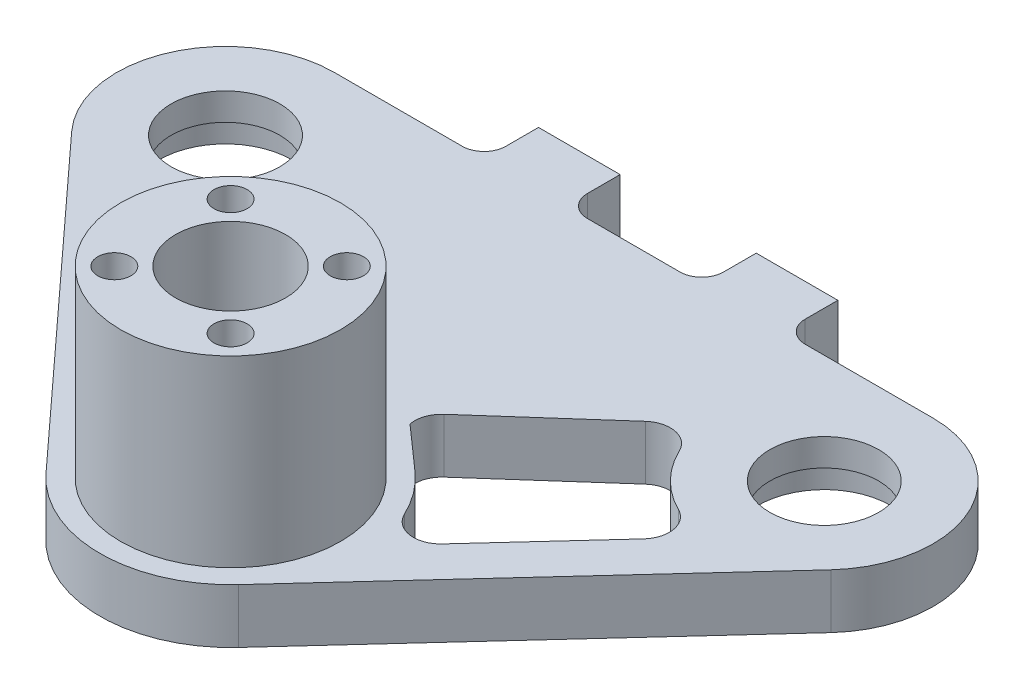
from build123d import *

# Parameters (mm, degrees)
SKETCH1_R              = 10.1
SKETCH1_R_2            = 10
MAIN_BODY_DEPTH        = 10
SKETCH2_R              = 12.2
BEARING_RECESS_DEPTH   = 5
STANDOFF_START         = 1.5
SKETCH3_R              = 21.5
SKETCH3_R_2            = 10.1
STANDOFF_SECTION_DEPTH = 1.5
SKETCH9_R              = 20.2
SKETCH9_R_2            = 10.1
BOSS_EXTRUDE1_DEPTH    = 33.7
EXTRA_GEOMETRY_DEPTH   = 10
SKETCH8_R              = 2
CUT_EXTRUDE1_DEPTH     = 6
SKETCH4_R              = 3.05
M6_BOLT_HOLES_DEPTH    = 122.389206984


with BuildPart() as part:
    # Sketch1 → Main Body (new body)
    with BuildSketch(Plane(origin=(0, 0, 0), x_dir=(1, 0, 0), z_dir=(0, 1, 0))):
        with BuildLine():
            Line((-69.741518057, 40.551033083), (-17.689821668, -16.219439242))
            ThreePointArc((-17.689821668, -16.219439242), (17.115072934, -16.824811395), (15.914514265, 17.96463848))
            Line((15.914514265, 17.96463848), (-41.737904779, 69.037764518))
            ThreePointArc((-41.737904779, 69.037764518), (-69.262560778, 68.087908614), (-69.741518057, 40.551033083))
        make_face()
        Circle(SKETCH1_R, mode=Mode.SUBTRACT)
        with Locations((-55, 54.067232452)):
            Circle(SKETCH1_R_2, mode=Mode.SUBTRACT)
        with BuildLine():
            Line((-47.625471592, 28.267691162), (-29.927098797, 8.964862385))
            ThreePointArc((-29.927098797, 8.964862385), (-25.488644513, 7.400949716), (-21.717284924, 10.215651499))
            ThreePointArc((-21.717284924, 10.215651499), (-17.115072934, 16.824811395), (-10.585592312, 21.539388))
            ThreePointArc((-10.585592312, 21.539388), (-7.835804554, 25.358336357), (-9.475400239, 29.769393516))
            Line((-9.475400239, 29.769393516), (-29.078104388, 47.135037426))
            ThreePointArc((-29.078104388, 47.135037426), (-33.398420323, 48.290403264), (-36.914902554, 45.527370018))
            ThreePointArc((-36.914902554, 45.527370018), (-40.737439222, 40.046556289), (-46.152073662, 36.130839294))
            ThreePointArc((-46.152073662, 36.130839294), (-48.85455966, 32.56761471), (-47.625471592, 28.267691162))
        make_face(mode=Mode.SUBTRACT)
    extrude(amount=MAIN_BODY_DEPTH)

    # Sketch2 → Bearing Recess (cut)
    with BuildSketch(Plane.XZ):
        with Locations((-55, -54.067232452)):
            Circle(SKETCH2_R)
    extrude(amount=-BEARING_RECESS_DEPTH, mode=Mode.SUBTRACT)

    # Sketch3 → Standoff Section (add)
    with BuildSketch(Plane.XZ.offset(STANDOFF_START)):
        Circle(SKETCH3_R)
        Circle(SKETCH3_R_2, mode=Mode.SUBTRACT)
    extrude(amount=-STANDOFF_SECTION_DEPTH)

    # Sketch9 → Boss-Extrude1 (add)
    with BuildSketch(Plane(origin=(0, 10, 0), x_dir=(1, 0, 0), z_dir=(0, 1, 0))):
        Circle(SKETCH9_R)
        Circle(SKETCH9_R_2, mode=Mode.SUBTRACT)
    extrude(amount=BOSS_EXTRUDE1_DEPTH)

    # Sketch6 → Extra Geometry (add)
    with BuildSketch(Plane(origin=(0, 0, 0), x_dir=(1, 0, 0), z_dir=(0, 1, 0))):
        with BuildLine():
            Line((0, 74.067232452), (0, 32.062988668))
            Line((0, 32.062988668), (-41.737904779, 69.037764518))
            ThreePointArc((-41.737904779, 69.037764518), (-47.908125823, 72.767642091), (-55, 74.067232452))
            Line((-55, 74.067232452), (-31.5, 74.067232452))
            ThreePointArc((-31.5, 74.067232452), (-28.671572875, 75.238805327), (-27.5, 78.067232452))
            Line((-27.5, 78.067232452), (-27.5, 84.067232452))
            Line((-27.5, 84.067232452), (-12.5, 84.067232452))
            Line((-12.5, 84.067232452), (-12.5, 78.067232452))
            ThreePointArc((-12.5, 78.067232452), (-11.328427125, 75.238805327), (-8.5, 74.067232452))
            Line((-8.5, 74.067232452), (0, 74.067232452))
        make_face()
    extrude(amount=EXTRA_GEOMETRY_DEPTH)

    # Sketch8 → Cut-Extrude1 (cut)
    with BuildSketch(Plane(origin=(0, 0, -84.067232452), x_dir=(-1, 0, 0), z_dir=(0, 0, -1))):
        with Locations((20, 5)):
            Circle(SKETCH8_R)
    extrude(amount=-CUT_EXTRUDE1_DEPTH, mode=Mode.SUBTRACT)

    # Mirror2: part across plane


with BuildPart() as part_1:
    add(part.part)
    add(part.part.mirror(Plane(origin=(0, 0, 0), x_dir=(0, 0, 1), z_dir=(1, 0, 0))))

    # Sketch4 → M6 Bolt holes (cut, through all)
    with BuildSketch(Plane.XZ.offset(1.5)):
        with Locations((-10.677312396, 10.677312396)):
            Circle(SKETCH4_R)
        with Locations((10.677312396, 10.677312396)):
            Circle(SKETCH4_R)
        with Locations((10.677312396, -10.677312396)):
            Circle(SKETCH4_R)
        with Locations((-10.677312396, -10.677312396)):
            Circle(SKETCH4_R)
    extrude(amount=-M6_BOLT_HOLES_DEPTH, mode=Mode.SUBTRACT)


solid = part_1.part
